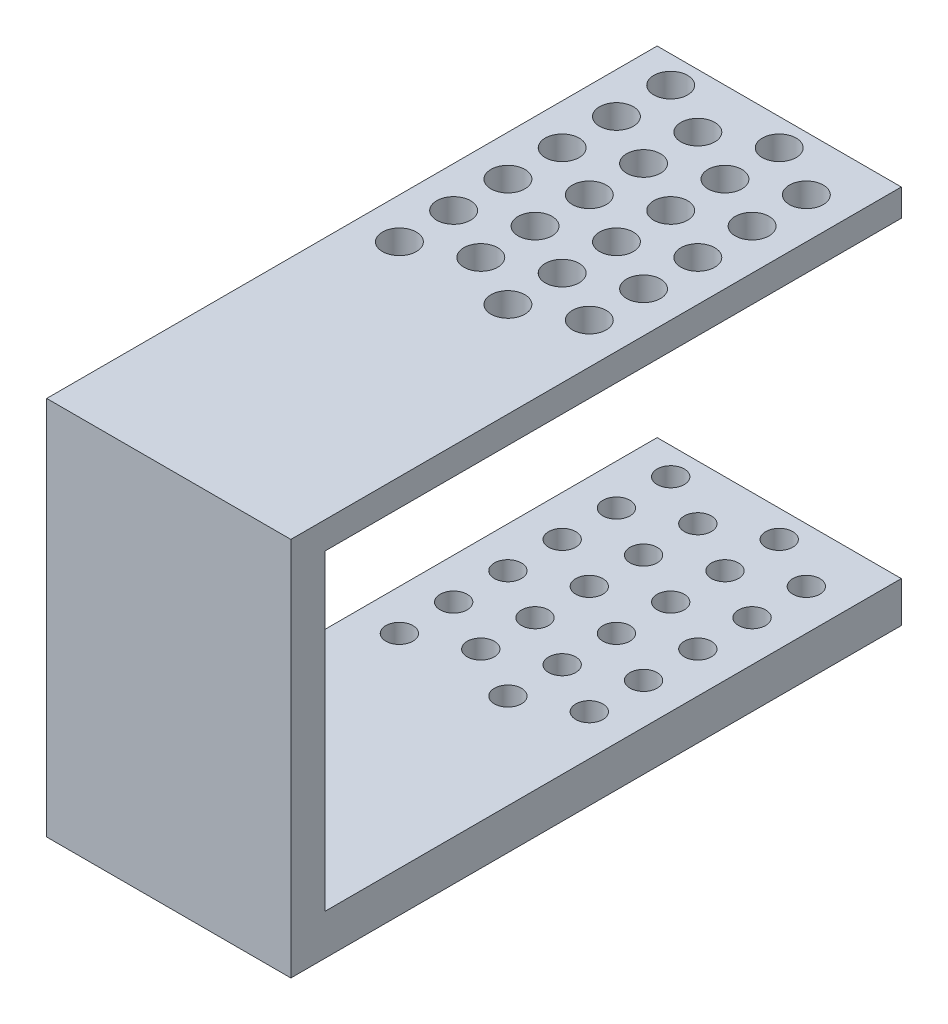
from build123d import *

# Parameters (mm, degrees)
SKETCH2_W           = 18
SKETCH2_H           = 24
SKETCH2_R           = 1.25
BOSS_EXTRUDE2_DEPTH = 2
SKETCH3_W           = 18
SKETCH3_H           = 2
BOSS_EXTRUDE3_DEPTH = 21
SKETCH4_W           = 18
SKETCH4_H           = 2.5
BOSS_EXTRUDE4_DEPTH = 26
SKETCH5_W           = 18
SKETCH5_H           = 3
BOSS_EXTRUDE5_DEPTH = 42.5
SKETCH15_R          = 1
CUT_EXTRUDE3_DEPTH  = 2


with BuildPart() as part:
    # Sketch2 → Boss-Extrude2 (new body)
    with BuildSketch(Plane(origin=(0, 0, 0), x_dir=(1, 0, 0), z_dir=(0, 1, 0))):
        with Locations((-11, 4)):
            Rectangle(SKETCH2_W, SKETCH2_H)
        with Locations((-17, -6)):
            Circle(SKETCH2_R, mode=Mode.SUBTRACT)
        with Locations((-17, -2)):
            Circle(SKETCH2_R, mode=Mode.SUBTRACT)
        with Locations((-17, 2)):
            Circle(SKETCH2_R, mode=Mode.SUBTRACT)
        with Locations((-17, 6)):
            Circle(SKETCH2_R, mode=Mode.SUBTRACT)
        with Locations((-17, 10)):
            Circle(SKETCH2_R, mode=Mode.SUBTRACT)
        with Locations((-17, 14)):
            Circle(SKETCH2_R, mode=Mode.SUBTRACT)
        with Locations((-13, -4)):
            Circle(SKETCH2_R, mode=Mode.SUBTRACT)
        with Locations((-13, 0)):
            Circle(SKETCH2_R, mode=Mode.SUBTRACT)
        with Locations((-13, 4)):
            Circle(SKETCH2_R, mode=Mode.SUBTRACT)
        with Locations((-13, 8)):
            Circle(SKETCH2_R, mode=Mode.SUBTRACT)
        with Locations((-13, 12)):
            Circle(SKETCH2_R, mode=Mode.SUBTRACT)
        with Locations((-9, -6)):
            Circle(SKETCH2_R, mode=Mode.SUBTRACT)
        with Locations((-9, -2)):
            Circle(SKETCH2_R, mode=Mode.SUBTRACT)
        with Locations((-9, 2)):
            Circle(SKETCH2_R, mode=Mode.SUBTRACT)
        with Locations((-9, 6)):
            Circle(SKETCH2_R, mode=Mode.SUBTRACT)
        with Locations((-9, 10)):
            Circle(SKETCH2_R, mode=Mode.SUBTRACT)
        with Locations((-9, 14)):
            Circle(SKETCH2_R, mode=Mode.SUBTRACT)
        with Locations((-5, -4)):
            Circle(SKETCH2_R, mode=Mode.SUBTRACT)
        with Locations((-5, 0)):
            Circle(SKETCH2_R, mode=Mode.SUBTRACT)
        with Locations((-5, 4)):
            Circle(SKETCH2_R, mode=Mode.SUBTRACT)
        with Locations((-5, 8)):
            Circle(SKETCH2_R, mode=Mode.SUBTRACT)
        with Locations((-5, 12)):
            Circle(SKETCH2_R, mode=Mode.SUBTRACT)
    extrude(amount=BOSS_EXTRUDE2_DEPTH)

    # Sketch3 → Boss-Extrude3 (add)
    with BuildSketch(Plane.XY.offset(8)):
        with Locations((-11, 1)):
            Rectangle(SKETCH3_W, SKETCH3_H)
    extrude(amount=BOSS_EXTRUDE3_DEPTH)

    # Sketch4 → Boss-Extrude4 (add)
    with BuildSketch(Plane(origin=(0, 0, 0), x_dir=(-1, 0, 0), z_dir=(0, -1, 0))):
        with Locations((11, -27.75)):
            Rectangle(SKETCH4_W, SKETCH4_H)
    extrude(amount=BOSS_EXTRUDE4_DEPTH)

    # Sketch5 → Boss-Extrude5 (add)
    with BuildSketch(Plane(origin=(0, 0, 26.5), x_dir=(-1, 0, 0), z_dir=(0, 0, -1))):
        with Locations((11, -24.5)):
            Rectangle(SKETCH5_W, SKETCH5_H)
    extrude(amount=BOSS_EXTRUDE5_DEPTH)

    # Sketch15 → Cut-Extrude3 (cut)
    with BuildSketch(Plane(origin=(0, -23, 0), x_dir=(1, 0, 0), z_dir=(0, 1, 0))):
        with Locations((-17, -6)):
            Circle(SKETCH15_R)
        with Locations((-17, -2)):
            Circle(SKETCH15_R)
        with Locations((-17, 2)):
            Circle(SKETCH15_R)
        with Locations((-17, 6)):
            Circle(SKETCH15_R)
        with Locations((-17, 10)):
            Circle(SKETCH15_R)
        with Locations((-17, 14)):
            Circle(SKETCH15_R)
        with Locations((-13, -4)):
            Circle(SKETCH15_R)
        with Locations((-13, 0)):
            Circle(SKETCH15_R)
        with Locations((-13, 4)):
            Circle(SKETCH15_R)
        with Locations((-13, 8)):
            Circle(SKETCH15_R)
        with Locations((-13, 12)):
            Circle(SKETCH15_R)
        with Locations((-9, -6)):
            Circle(SKETCH15_R)
        with Locations((-9, -2)):
            Circle(SKETCH15_R)
        with Locations((-9, 2)):
            Circle(SKETCH15_R)
        with Locations((-9, 6)):
            Circle(SKETCH15_R)
        with Locations((-9, 10)):
            Circle(SKETCH15_R)
        with Locations((-9, 14)):
            Circle(SKETCH15_R)
        with Locations((-5, -4)):
            Circle(SKETCH15_R)
        with Locations((-5, 0)):
            Circle(SKETCH15_R)
        with Locations((-5, 4)):
            Circle(SKETCH15_R)
        with Locations((-5, 8)):
            Circle(SKETCH15_R)
        with Locations((-5, 12)):
            Circle(SKETCH15_R)
    extrude(amount=-CUT_EXTRUDE3_DEPTH, mode=Mode.SUBTRACT)


solid = part.part
